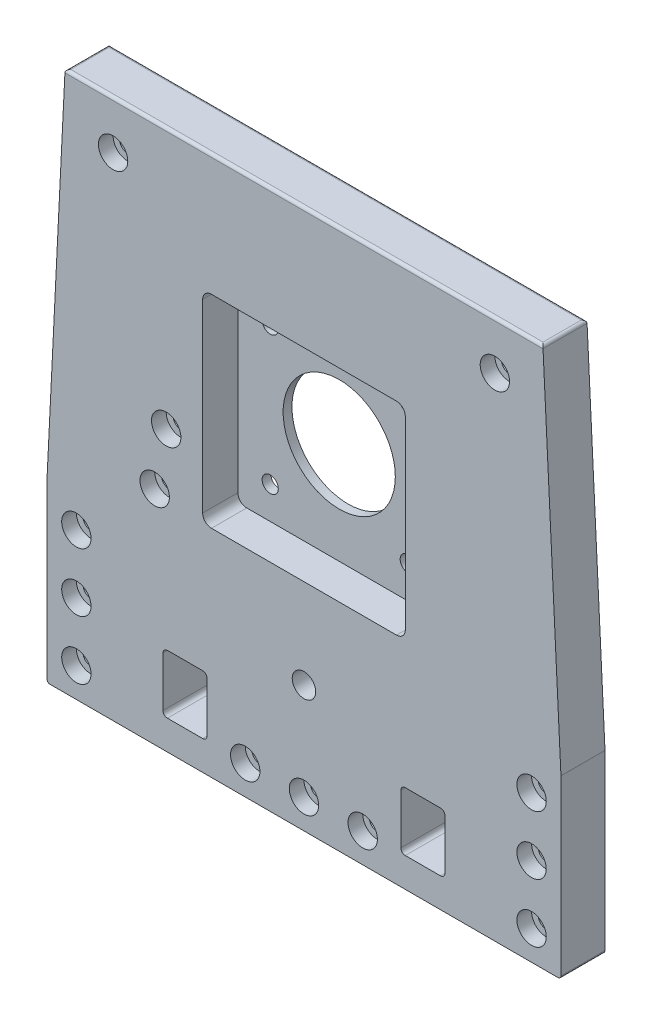
from build123d import *

# Parameters (mm, degrees)
PANEL_SKETCH_W                           = 15
PANEL_SKETCH_H                           = 20
PLATE_EXTRUSION_DEPTH                    = 15
EXTERNAL_EDGE_FILLET_R                   = 1
INTERNAL_EDGE_FILLET_R                   = 1.5
CBORE_FOR_M5_SHCS2_D                     = 5.5
CBORE_FOR_M5_SHCS2_CBORE_D               = 10
CBORE_FOR_M5_SHCS2_CBORE_DEPTH           = 5
M5_CLEARANCE_HOLE1_D                     = 5.5
F_8_0MM_DOWEL_HOLE1_D                    = 8
Y_DRIVE_SKETCH_R                         = 19.1
STEPPER_CENTERING_HOLE_CUT_EXTRUDE_DEPTH = 181.666190805
Y_DRIVE_SKETCH_3_W                       = 69
Y_DRIVE_SKETCH_3_H                       = 69
Y_DRIVE_SKETCH_3_R                       = 19.1
STEPPER_RECESS_CUT_EXTRUDE_DEPTH         = 12
FILLET2_R                                = 3
CBORE_FOR_M5_SHCS3_D                     = 5.3
CBORE_FOR_M5_SHCS3_CBORE_D               = 10
CBORE_FOR_M5_SHCS3_CBORE_DEPTH           = 5


with BuildPart() as part:
    # Panel Sketch → Plate Extrusion (new body)
    with BuildSketch(Plane.XY):
        Polygon((-87.5, 33.5), (-87.5, -26.5), (87.5, -26.5), (87.5, 33.5), (81.35, 157.35), (-81.35, 157.35), align=None)
        with Locations((-40.5, -6.5)):
            Rectangle(PANEL_SKETCH_W, PANEL_SKETCH_H, mode=Mode.SUBTRACT)
        with Locations((40.5, -6.5)):
            Rectangle(PANEL_SKETCH_W, PANEL_SKETCH_H, mode=Mode.SUBTRACT)
    extrude(amount=-PLATE_EXTRUSION_DEPTH)

    # External Edge Fillet
    external_edge_fillet_edges = [part.edges().sort_by_distance(p)[0] for p in [
        (-87.5, -26.5, -7.5),
        (87.5, -26.5, -7.5),
        (-81.35, 157.35, -7.5),
        (0, 157.35, -15),
        (81.35, 157.35, -7.5),
        (0, 157.35, 0),
        (-87.5, 33.5, -7.5),
        (87.5, 33.5, -7.5),
    ]]
    fillet(external_edge_fillet_edges, radius=EXTERNAL_EDGE_FILLET_R)

    # Internal Edge Fillet
    internal_edge_fillet_edges = [part.edges().sort_by_distance(p)[0] for p in [
        (-48, 3.5, -7.5),
        (33, 3.5, -7.5),
        (48, 3.5, -7.5),
        (-33, 3.5, -7.5),
        (-33, -16.5, -7.5),
        (48, -16.5, -7.5),
        (33, -16.5, -7.5),
        (-48, -16.5, -7.5),
    ]]
    fillet(internal_edge_fillet_edges, radius=INTERNAL_EDGE_FILLET_R)

    # CBORE for M5 SHCS2 (through all)
    with Locations(Plane.XY):
        with Locations((-77.5, 23.5), (-77.5, 3.5), (-77.5, -16.5), (-20, -16.5), (0, -16.5), (20, -16.5), (77.5, -16.5), (77.5, 3.5), (77.5, 23.5), (-65, 141), (65, 141)):
            CounterBoreHole(CBORE_FOR_M5_SHCS2_D / 2, CBORE_FOR_M5_SHCS2_CBORE_D / 2, CBORE_FOR_M5_SHCS2_CBORE_DEPTH)

    # M5 Clearance Hole1 (through all)
    with Locations(Plane.XY):
        with Locations((-23.5, 105), (23.5, 105), (23.5, 58), (-23.5, 58)):
            Hole(M5_CLEARANCE_HOLE1_D / 2)

    # Ø8.0mm Dowel Hole1 (through all)
    with Locations(Plane.XY):
        with Locations((0, 16.5)):
            Hole(F_8_0MM_DOWEL_HOLE1_D / 2)

    # Y Drive Sketch → Stepper Centering Hole Cut-Extrude (cut, through all)
    with BuildSketch(Plane.XY):
        with Locations((0, 81.5)):
            Circle(Y_DRIVE_SKETCH_R)
    extrude(amount=-STEPPER_CENTERING_HOLE_CUT_EXTRUDE_DEPTH, mode=Mode.SUBTRACT)

    # Y Drive Sketch<3> → Stepper Recess Cut-Extrude (cut)
    with BuildSketch(Plane.XY):
        with Locations((0, 81.5)):
            Rectangle(Y_DRIVE_SKETCH_3_W, Y_DRIVE_SKETCH_3_H)
        with Locations((0, 81.5)):
            Circle(Y_DRIVE_SKETCH_3_R, mode=Mode.SUBTRACT)
    extrude(amount=-STEPPER_RECESS_CUT_EXTRUDE_DEPTH, mode=Mode.SUBTRACT)

    # Fillet2
    fillet2_edges = [part.edges().sort_by_distance(p)[0] for p in [
        (34.5, 47, -6),
        (34.5, 116, -6),
        (-34.5, 116, -6),
        (-34.5, 47, -6),
    ]]
    fillet(fillet2_edges, radius=FILLET2_R)

    # CBORE for M5 SHCS3 (through all)
    with Locations(Plane.XY):
        with Locations((-46.912082235, 68.568372474), (-50.829742373, 48.955827024)):
            CounterBoreHole(CBORE_FOR_M5_SHCS3_D / 2, CBORE_FOR_M5_SHCS3_CBORE_D / 2, CBORE_FOR_M5_SHCS3_CBORE_DEPTH)


solid = part.part
